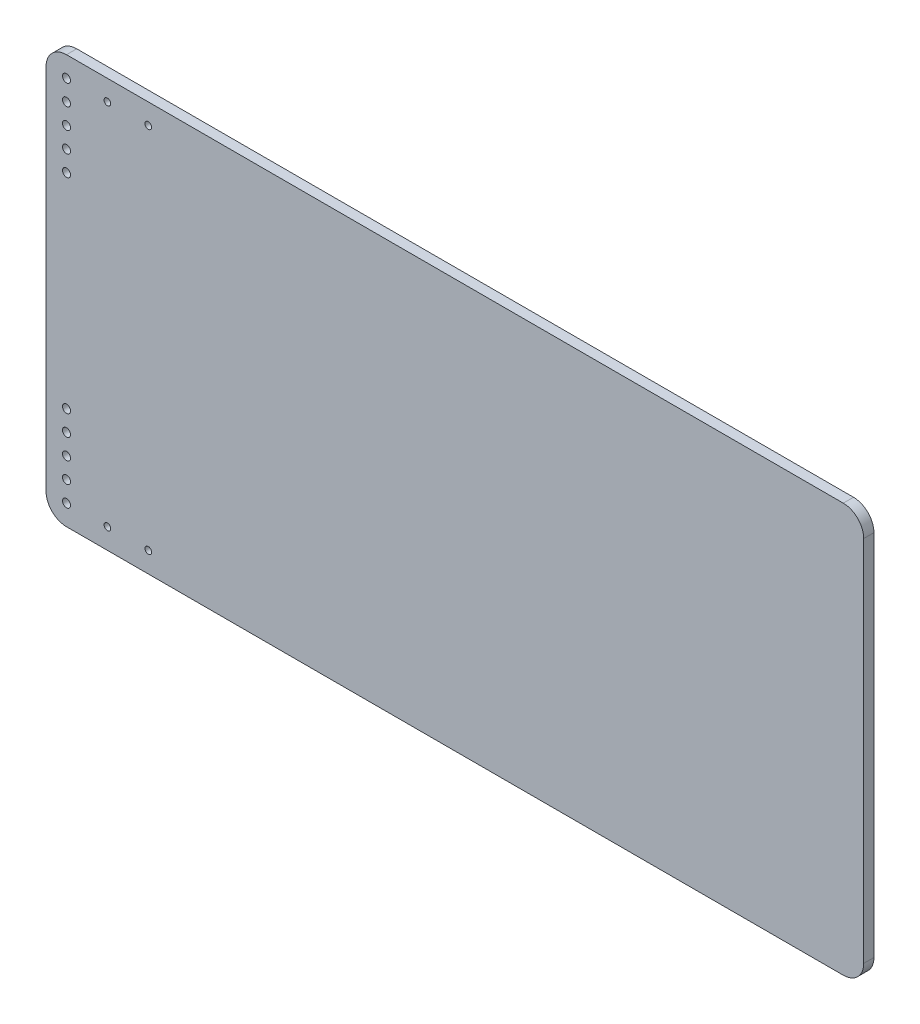
from build123d import *

# Parameters (mm, degrees)
BOSS_EXTRUDE1_DEPTH = 6.35
SKETCH2_R           = 2.5
SKETCH2_R_2         = 2.4892
SKETCH2_R_3         = 2.0701
CUT_EXTRUDE1_DEPTH  = 568.996762755


with BuildPart() as part:
    # Sketch1 → Boss-Extrude1 (new body)
    with BuildSketch(Plane.XY):
        with BuildLine():
            Line((12.7, 0), (495.3, 0))
            ThreePointArc((495.3, 0), (504.280256121, 3.719743879), (508, 12.7))
            Line((508, 12.7), (508, 241.3))
            ThreePointArc((508, 241.3), (504.280256121, 250.280256121), (495.3, 254))
            Line((495.3, 254), (12.7, 254))
            ThreePointArc((12.7, 254), (3.719743879, 250.280256121), (0, 241.3))
            Line((0, 241.3), (0, 12.7))
            ThreePointArc((0, 12.7), (3.719743879, 3.719743879), (12.7, 0))
        make_face()
    extrude(amount=BOSS_EXTRUDE1_DEPTH)

    # Sketch2 → Cut-Extrude1 (cut, through all)
    with BuildSketch(Plane.XY.offset(6.35)):
        with Locations((12.7, 190.5)):
            Circle(SKETCH2_R)
        with Locations((12.7, 203.2)):
            Circle(SKETCH2_R)
        with Locations((12.7, 215.9)):
            Circle(SKETCH2_R)
        with Locations((12.7, 228.6)):
            Circle(SKETCH2_R)
        with Locations((12.7, 241.3)):
            Circle(SKETCH2_R_2)
        with Locations((38.1, 241.3)):
            Circle(SKETCH2_R_3)
        with Locations((63.5, 241.3)):
            Circle(SKETCH2_R_3)
        with Locations((63.5, 12.7)):
            Circle(SKETCH2_R_3)
        with Locations((38.1, 12.7)):
            Circle(SKETCH2_R_3)
        with Locations((12.7, 63.5)):
            Circle(SKETCH2_R)
        with Locations((12.7, 50.8)):
            Circle(SKETCH2_R)
        with Locations((12.7, 38.1)):
            Circle(SKETCH2_R)
        with Locations((12.7, 25.4)):
            Circle(SKETCH2_R)
        with Locations((12.7, 12.7)):
            Circle(SKETCH2_R_2)
    extrude(amount=-CUT_EXTRUDE1_DEPTH, mode=Mode.SUBTRACT)


solid = part.part
